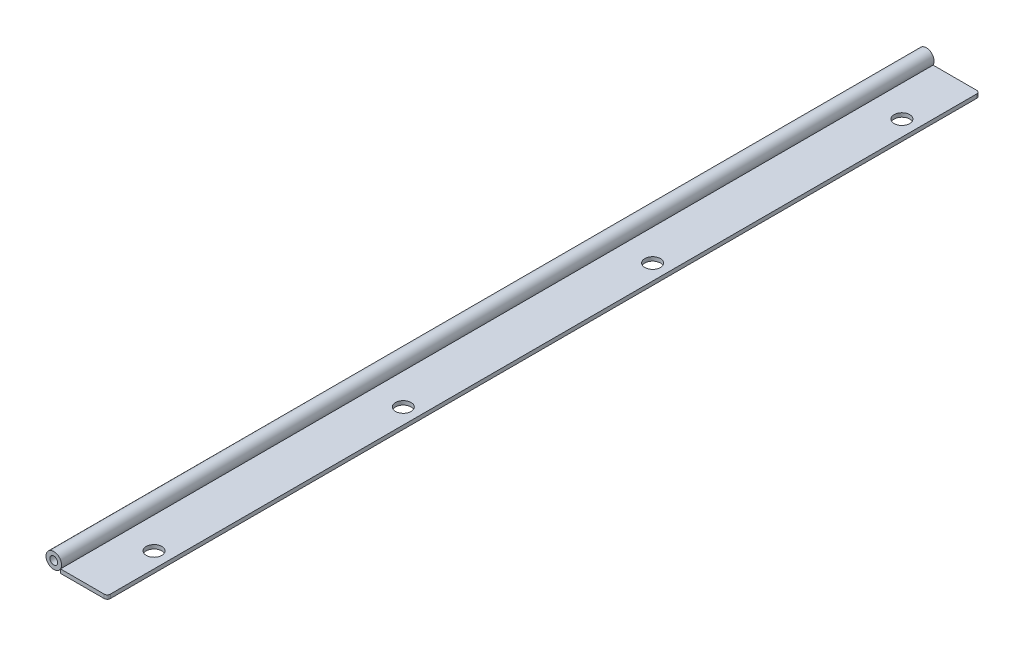
from build123d import *

# Parameters (mm, degrees)
SKETCH1_W           = 38.1
SKETCH1_H           = 711.2
BOSS_EXTRUDE1_DEPTH = 3.175
FILLET1_R           = 2.54
SKETCH3_R           = 6.35
SKETCH3_R_2         = 3.175
BOSS_EXTRUDE2_DEPTH = 711.2
SKETCH4_R           = 6.35
CUT_EXTRUDE2_DEPTH  = 713.333026049


with BuildPart() as part:
    # Sketch1 → Boss-Extrude1 (new body)
    with BuildSketch(Plane(origin=(0, 0, 0), x_dir=(1, 0, 0), z_dir=(0, 1, 0))):
        with Locations((19.05, 355.6)):
            Rectangle(SKETCH1_W, SKETCH1_H)
    extrude(amount=BOSS_EXTRUDE1_DEPTH)

    # Fillet1
    fillet1_edges = [part.edges().sort_by_distance(p)[0] for p in [
        (38.1, 1.5875, 0),
        (38.1, 1.5875, -711.2),
    ]]
    fillet(fillet1_edges, radius=FILLET1_R)

    # Sketch4 → Cut-Extrude2 (cut, through all)
    with BuildSketch(Plane(origin=(0, 0, 0), x_dir=(-1, 0, 0), z_dir=(0, -1, 0))):
        with Locations((-25.4, 660.4)):
            Circle(SKETCH4_R)
        with Locations((-25.4, 457.2)):
            Circle(SKETCH4_R)
        with Locations((-25.4, 254)):
            Circle(SKETCH4_R)
        with Locations((-25.4, 50.8)):
            Circle(SKETCH4_R)
    extrude(amount=-CUT_EXTRUDE2_DEPTH, mode=Mode.SUBTRACT)


with BuildPart() as body_2:
    # Sketch3 → Boss-Extrude2 (new body)
    with BuildSketch(Plane.XY):
        with Locations((-5.499261314, 6.35)):
            Circle(SKETCH3_R)
        with Locations((-5.499261314, 6.35)):
            Circle(SKETCH3_R_2, mode=Mode.SUBTRACT)
    extrude(amount=-BOSS_EXTRUDE2_DEPTH)


solid = Compound([part.part, body_2.part])
